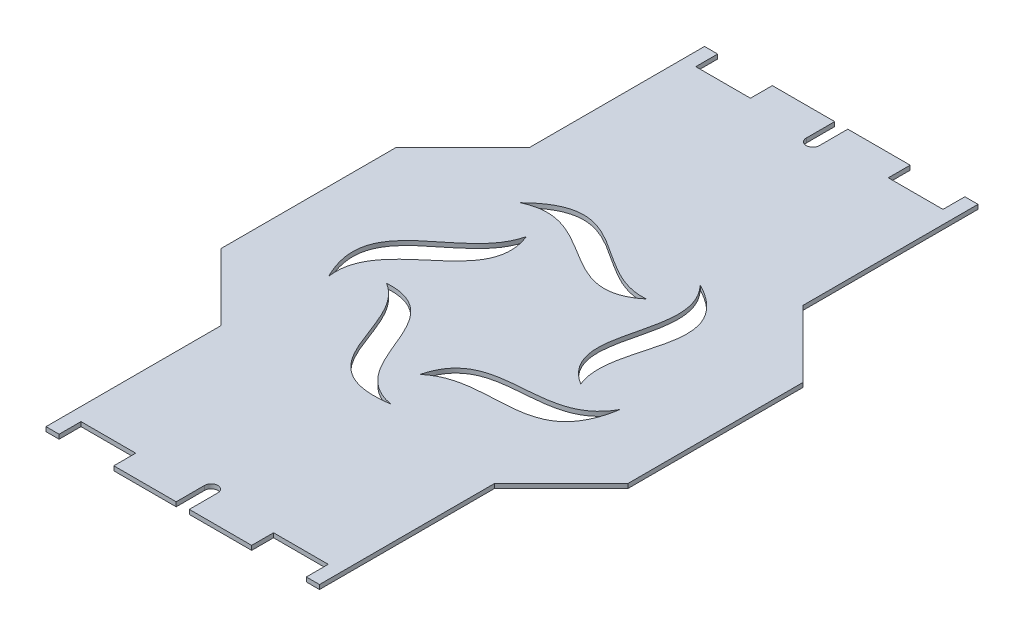
from build123d import *

# Parameters (mm, degrees)
BOSS_EXTRUDE1_DEPTH = 2
CUT_EXTRUDE1_DEPTH  = 10
CUT_EXTRUDE2_DEPTH  = 10
SKETCH4_W           = 25
SKETCH4_H           = 20
CUT_EXTRUDE3_DEPTH  = 10


with BuildPart() as part:
    # Sketch1 → Boss-Extrude1 (new body)
    with BuildSketch(Plane(origin=(0, 0, 0), x_dir=(1, 0, 0), z_dir=(0, 1, 0))):
        Polygon((62.5, 150.5), (-62.5, 150.5), (-62.5, 70.5), (-93, 40), (-93, -40), (-62.5, -70.5), (-62.5, -150.5), (62.5, -150.5), (62.5, -70.5), (93, -40), (93, 40), (62.5, 70.5), align=None)
    extrude(amount=BOSS_EXTRUDE1_DEPTH)

    # Sketch2 → Cut-Extrude1 (cut)
    with BuildSketch(Plane(origin=(0, 2, 0), x_dir=(1, 0, 0), z_dir=(0, 1, 0))):
        with BuildLine():
            Line((3, 150.5), (-3, 150.5))
            Line((-3, 150.5), (-3, 137.5))
            ThreePointArc((-3, 137.5), (0, 134.5), (3, 137.5))
            Line((3, 137.5), (3, 150.5))
        make_face()
        with BuildLine():
            Line((-3, -150.5), (3, -150.5))
            Line((3, -150.5), (3, -137.5))
            ThreePointArc((3, -137.5), (0, -134.5), (-3, -137.5))
            Line((-3, -137.5), (-3, -150.5))
        make_face()
    extrude(amount=-CUT_EXTRUDE1_DEPTH, mode=Mode.SUBTRACT)

    # Sketch3 → Cut-Extrude2 (cut)
    with BuildSketch(Plane(origin=(0, 2, 0), x_dir=(1, 0, 0), z_dir=(0, 1, 0))):
        with BuildLine():
            add(Edge.make_bspline(
                [(61.935330863, -12.480671207), (48.18812645, -37.764846848), (10.15230333, -13.930676571), (2.340125851, -44.306382784)],
                knots=[0, 0, 0, 0, 1, 1, 1, 1], degree=3))
            add(Edge.make_bspline(
                [(61.935330863, -12.480671207), (55.762093107, -50.458165256), (21.338028868, -28.075008023), (2.340125851, -44.306382784)],
                knots=[0, 0, 0, 0, 1, 1, 1, 1], degree=3))
        make_face()
        with BuildLine():
            add(Edge.make_bspline(
                [(7.26924611, -62.76073951), (-21.025553682, -57.499611134), (-10.111626468, -13.960230041), (-41.414735403, -15.917017179)],
                knots=[0, 0, 0, 0, 1, 1, 1, 1], degree=3))
            add(Edge.make_bspline(
                [(7.26924611, -62.76073951), (-30.757132455, -68.62533258), (-20.107105779, -28.969325996), (-41.414735403, -15.917017179)],
                knots=[0, 0, 0, 0, 1, 1, 1, 1], degree=3))
        make_face()
        with BuildLine():
            add(Edge.make_bspline(
                [(-57.442689694, -26.30759897), (-61.182633257, 2.228132827), (-16.401632169, 5.302779915), (-27.935839965, 34.469125167)],
                knots=[0, 0, 0, 0, 1, 1, 1, 1], degree=3))
            add(Edge.make_bspline(
                [(-57.442689694, -26.30759897), (-74.77104636, 8.045377232), (-33.764903654, 10.170979926), (-27.935839965, 34.469125167)],
                knots=[0, 0, 0, 0, 1, 1, 1, 1], degree=3))
        make_face()
        with BuildLine():
            add(Edge.make_bspline(
                [(-42.770780746, 46.501749184), (-16.787393193, 58.876672953), (-0.025139683, 17.237528263), (24.1494368, 37.220108095)],
                knots=[0, 0, 0, 0, 1, 1, 1, 1], degree=3))
            add(Edge.make_bspline(
                [(-42.770780746, 46.501749184), (-15.45391557, 73.597649162), (-0.760752306, 35.255337289), (24.1494368, 37.220108095)],
                knots=[0, 0, 0, 0, 1, 1, 1, 1], degree=3))
        make_face()
        with BuildLine():
            add(Edge.make_bspline(
                [(31.008893468, 55.047260502), (50.807453682, 34.159652202), (16.38609499, 5.350598434), (42.861012717, -11.4658333)],
                knots=[0, 0, 0, 0, 1, 1, 1, 1], degree=3))
            add(Edge.make_bspline(
                [(31.008893468, 55.047260502), (65.220001279, 37.440471442), (33.294732872, 11.618016803), (42.861012717, -11.4658333)],
                knots=[0, 0, 0, 0, 1, 1, 1, 1], degree=3))
        make_face()
    extrude(amount=-CUT_EXTRUDE2_DEPTH, mode=Mode.SUBTRACT)

    # Sketch4 → Cut-Extrude3 (cut)
    with BuildSketch(Plane(origin=(0, 2, 0), x_dir=(1, 0, 0), z_dir=(0, 1, 0))):
        with Locations((44, 150.5)):
            Rectangle(SKETCH4_W, SKETCH4_H)
        with Locations((-44, 150.5)):
            Rectangle(SKETCH4_W, SKETCH4_H)
        with Locations((-44, -150.5)):
            Rectangle(SKETCH4_W, SKETCH4_H)
        with Locations((44, -150.5)):
            Rectangle(SKETCH4_W, SKETCH4_H)
    extrude(amount=-CUT_EXTRUDE3_DEPTH, mode=Mode.SUBTRACT)


solid = part.part
